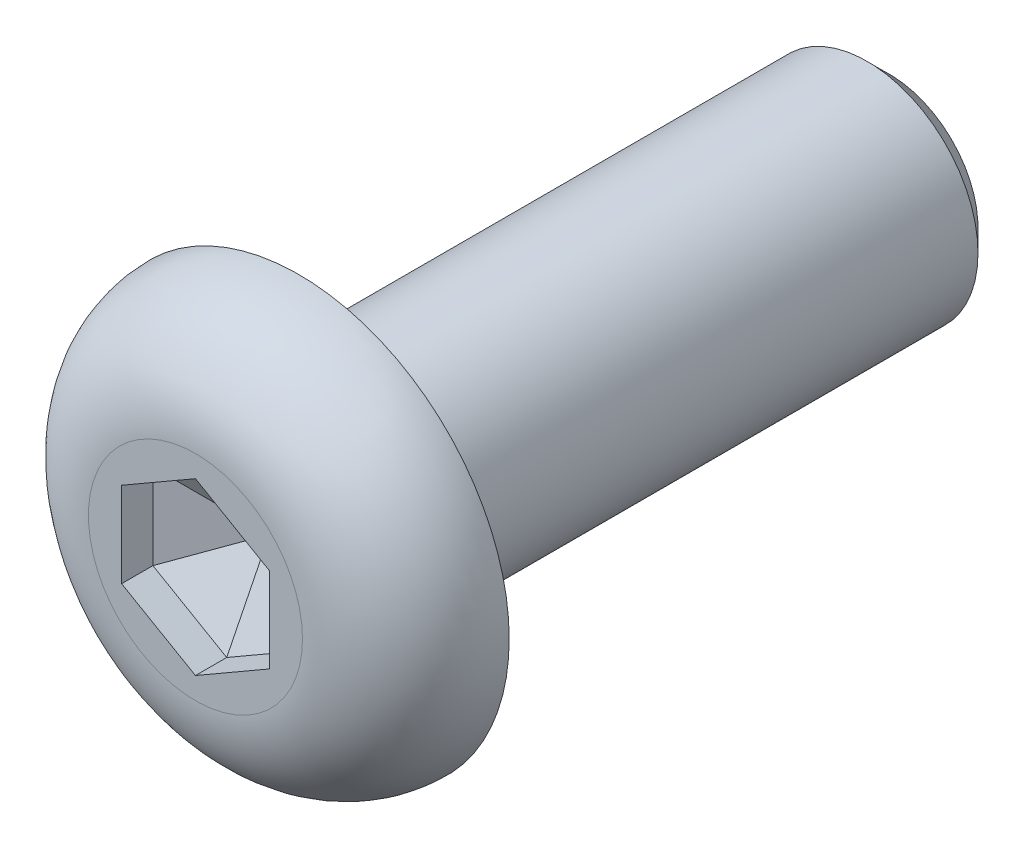
from build123d import *
from OCP.BRepFilletAPI import BRepFilletAPI_MakeChamfer

# Parameters (mm, degrees)
SKETCH_1_R          = 2.85
EXTRUDE_1_DEPTH     = 1.4
FILLET_1_R          = 1.4
SKETCH_3_R          = 1.5
EXTRUDE_3_DEPTH     = 8
CUT_EXTRUDE_1_DEPTH = 1
CHAMFER_2_SIZE      = 0.3
CHAMFER_3_SIZE      = 0.576368876
CHAMFER_3_SIZE2     = 0.998300177
FILLET_2_R          = 0.1


with BuildPart() as part:
    # 草图1 → 凸台-拉伸1 (new body)
    with BuildSketch(Plane.XY):
        Circle(SKETCH_1_R)
    extrude(amount=EXTRUDE_1_DEPTH)

    # 圆角1
    fillet_1_edges = [part.edges().sort_by_distance(p)[0] for p in [
        (-2.85, 0, 1.4),
    ]]
    fillet(fillet_1_edges, radius=FILLET_1_R - 0.0001)  # a hair under: the kernel refuses the full size

    # 草图3 → 凸台-拉伸3 (add)
    with BuildSketch(Plane(origin=(0, 0, 0), x_dir=(-1, 0, 0), z_dir=(0, 0, -1))):
        with Locations(Location((0, 0, 0), (0, 0, 180))):
            Circle(SKETCH_3_R)
    extrude(amount=EXTRUDE_3_DEPTH)

    # 草图4 → 切除-拉伸1 (cut)
    with BuildSketch(Plane.XY.offset(1.4)):
        Polygon((1, 0.577350269), (0, 1.154700538), (-1, 0.577350269), (-1, -0.577350269), (0, -1.154700538), (1, -0.577350269), align=None)
    extrude(amount=-CUT_EXTRUDE_1_DEPTH, mode=Mode.SUBTRACT)

    # 倒角2
    chamfer_2_edges = [part.edges().sort_by_distance(p)[0] for p in [
        (-1.5, 0, -8),
    ]]
    chamfer(chamfer_2_edges, length=CHAMFER_2_SIZE)

    # 倒角3: one chamfer whose edges measure the first distance from different faces: ONE call of the kernel's chamfer builder (chamfer() names one face for all edges)
    chamfer_3_edges_1 = [part.edges().sort_by_distance(p)[0] for p in [
        (1, 0, 0.4),
    ]]
    chamfer_3_side_1 = [part.faces().sort_by_distance(p)[0] for p in [
        (1, 0, 0.9),
    ]]
    chamfer_3_edges_2 = [part.edges().sort_by_distance(p)[0] for p in [
        (0.5, -0.866025404, 0.4),
    ]]
    chamfer_3_side_2 = [part.faces().sort_by_distance(p)[0] for p in [
        (0.5, -0.866025404, 0.9),
    ]]
    chamfer_3_edges_3 = [part.edges().sort_by_distance(p)[0] for p in [
        (-0.5, -0.866025404, 0.4),
    ]]
    chamfer_3_side_3 = [part.faces().sort_by_distance(p)[0] for p in [
        (-0.5, -0.866025404, 0.9),
    ]]
    chamfer_3_edges_4 = [part.edges().sort_by_distance(p)[0] for p in [
        (-1, 0, 0.4),
    ]]
    chamfer_3_side_4 = [part.faces().sort_by_distance(p)[0] for p in [
        (-1, 0, 0.9),
    ]]
    chamfer_3_edges_5 = [part.edges().sort_by_distance(p)[0] for p in [
        (-0.5, 0.866025404, 0.4),
    ]]
    chamfer_3_side_5 = [part.faces().sort_by_distance(p)[0] for p in [
        (-0.5, 0.866025404, 0.9),
    ]]
    chamfer_3_edges_6 = [part.edges().sort_by_distance(p)[0] for p in [
        (0.5, 0.866025404, 0.4),
    ]]
    chamfer_3_side_6 = [part.faces().sort_by_distance(p)[0] for p in [
        (0.5, 0.866025404, 0.9),
    ]]
    chamfer_3 = BRepFilletAPI_MakeChamfer(part.part.solid().wrapped)
    for e in chamfer_3_edges_1:
        chamfer_3.Add(CHAMFER_3_SIZE, CHAMFER_3_SIZE2, e.wrapped, chamfer_3_side_1[0].wrapped)  # the first distance lies on this face
    for e in chamfer_3_edges_2:
        chamfer_3.Add(CHAMFER_3_SIZE, CHAMFER_3_SIZE2, e.wrapped, chamfer_3_side_2[0].wrapped)  # the first distance lies on this face
    for e in chamfer_3_edges_3:
        chamfer_3.Add(CHAMFER_3_SIZE, CHAMFER_3_SIZE2, e.wrapped, chamfer_3_side_3[0].wrapped)  # the first distance lies on this face
    for e in chamfer_3_edges_4:
        chamfer_3.Add(CHAMFER_3_SIZE, CHAMFER_3_SIZE2, e.wrapped, chamfer_3_side_4[0].wrapped)  # the first distance lies on this face
    for e in chamfer_3_edges_5:
        chamfer_3.Add(CHAMFER_3_SIZE, CHAMFER_3_SIZE2, e.wrapped, chamfer_3_side_5[0].wrapped)  # the first distance lies on this face
    for e in chamfer_3_edges_6:
        chamfer_3.Add(CHAMFER_3_SIZE, CHAMFER_3_SIZE2, e.wrapped, chamfer_3_side_6[0].wrapped)  # the first distance lies on this face
    add(Compound.cast(chamfer_3.Shape()), mode=Mode.REPLACE)

    # 圆角2
    fillet_2_edges = [part.edges().sort_by_distance(p)[0] for p in [
        (-1.5, 0, 0),
    ]]
    fillet(fillet_2_edges, radius=FILLET_2_R)


solid = part.part
